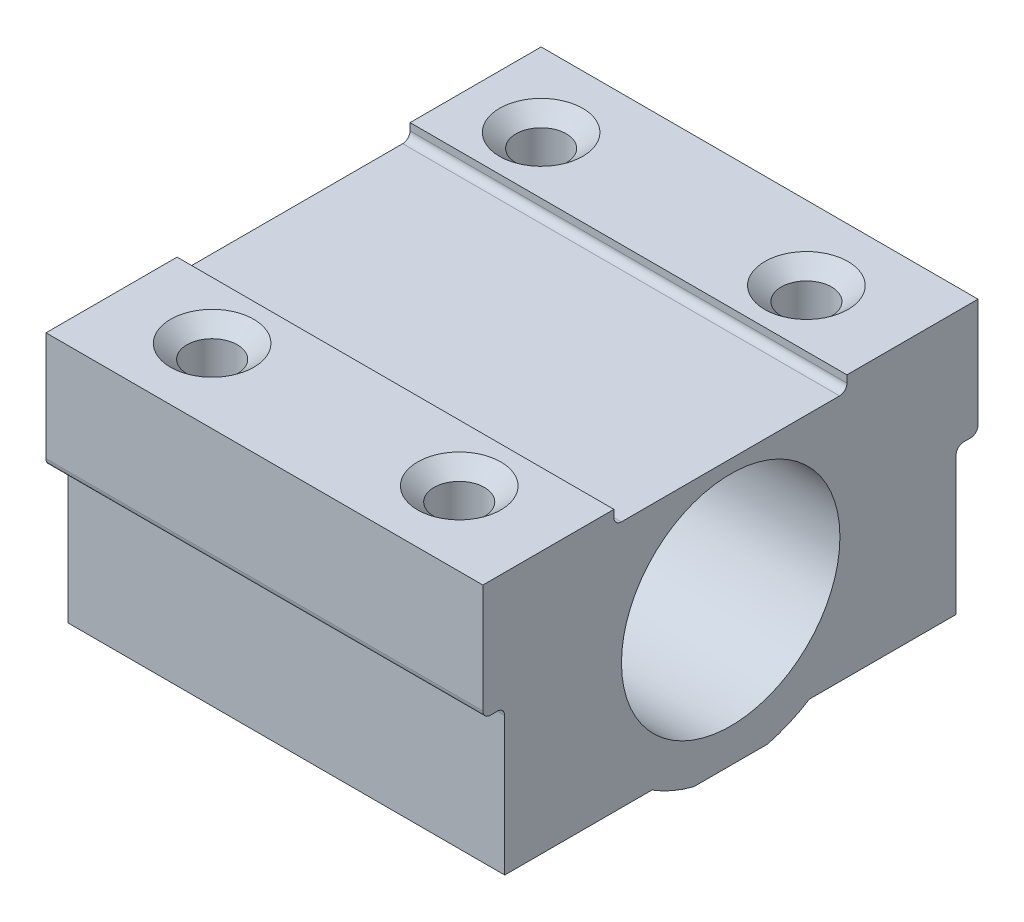
from build123d import *

# Parameters (mm, degrees)
SKETCH1_R                                         = 7.5
BOSS_EXTRUDE1_DEPTH                               = 30
CSK_FOR_4_FLAT_HEAD_MACHINE_SCREW_100_D           = 3.4544
CSK_FOR_4_FLAT_HEAD_MACHINE_SCREW_100_DEPTH       = 6.35
CSK_FOR_4_FLAT_HEAD_MACHINE_SCREW_100_CSINK_D     = 5.715
CSK_FOR_4_FLAT_HEAD_MACHINE_SCREW_100_CSINK_ANGLE = 100
CSK_FOR_4_FLAT_HEAD_MACHINE_SCREW_100_TIP         = 1.037806461
FILLET1_R                                         = 0.508


with BuildPart() as part:
    # Sketch1 → Boss-Extrude1 (new body)
    with BuildSketch(Plane(origin=(0, 0, 0), x_dir=(0, 0, -1), z_dir=(1, 0, 0))):
        with BuildLine():
            Line((32.5, 0), (34, 0))
            Line((34, 0), (34, 7.49375))
            Line((34, 7.49375), (34, 8))
            Line((34, 8), (25, 8))
            Line((25, 8), (25, 7))
            Line((25, 7), (9, 7))
            Line((9, 7), (9, 8))
            Line((9, 8), (0, 8))
            Line((0, 8), (0, 7.49375))
            Line((0, 7.49375), (0, 0))
            Line((0, 0), (1.5, 0))
            Line((1.5, 0), (1.5, -10))
            Line((1.5, -10), (11.611411797, -10))
            ThreePointArc((11.611411797, -10), (13.001010498, -10.730169916), (14.486500092, -11.237568497))
            Line((14.486500092, -11.237568497), (19.549499908, -11.237568497))
            ThreePointArc((19.549499908, -11.237568497), (21.034989502, -10.730169916), (22.424588203, -10))
            Line((22.424588203, -10), (32.5, -10))
            Line((32.5, -10), (32.5, 0))
        make_face()
        with Locations((17.018, -1.398)):
            Circle(SKETCH1_R, mode=Mode.SUBTRACT)
    extrude(amount=BOSS_EXTRUDE1_DEPTH)

    # CSK for #4 Flat Head Machine Screw (100)1
    with Locations(Plane(origin=(0, 8, 0), x_dir=(1, 0, 0), z_dir=(0, 1, 0))):
        with Locations((5.08, 28.92), (23.295710441, 28.92), (23.295710441, 5.08), (6.329342194, 5.08)):
            CounterSinkHole(CSK_FOR_4_FLAT_HEAD_MACHINE_SCREW_100_D / 2, CSK_FOR_4_FLAT_HEAD_MACHINE_SCREW_100_CSINK_D / 2, depth=CSK_FOR_4_FLAT_HEAD_MACHINE_SCREW_100_DEPTH, counter_sink_angle=CSK_FOR_4_FLAT_HEAD_MACHINE_SCREW_100_CSINK_ANGLE)
            with Locations((0, 0, -(CSK_FOR_4_FLAT_HEAD_MACHINE_SCREW_100_DEPTH + CSK_FOR_4_FLAT_HEAD_MACHINE_SCREW_100_TIP / 2))):  # 118° drill point
                Cone(0, CSK_FOR_4_FLAT_HEAD_MACHINE_SCREW_100_D / 2, CSK_FOR_4_FLAT_HEAD_MACHINE_SCREW_100_TIP, mode=Mode.SUBTRACT)

    # Fillet1
    fillet1_edges = [part.edges().sort_by_distance(p)[0] for p in [
        (15, 7, -25),
        (15, 7, -9),
        (15, 0, -34),
        (15, 0, -32.5),
        (15, 0, 0),
        (15, 0, -1.5),
    ]]
    fillet(fillet1_edges, radius=FILLET1_R)


solid = part.part
